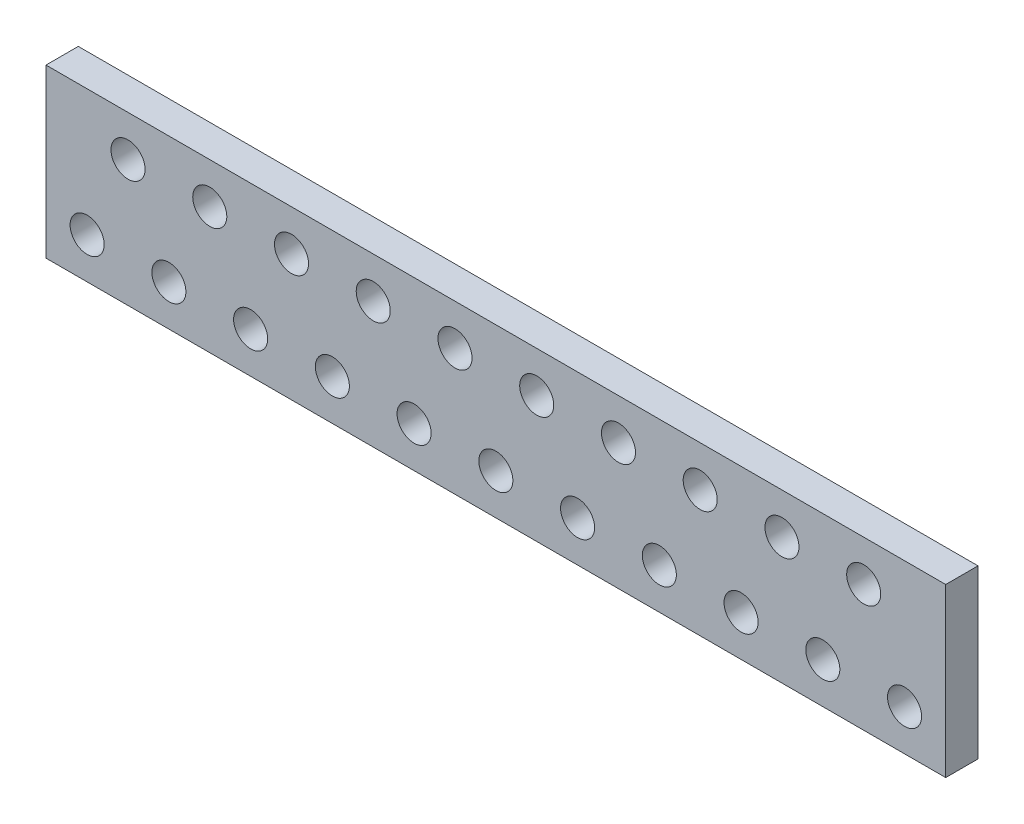
from build123d import *

# Parameters (mm, degrees)
SKETCH1_W          = 39.624
SKETCH1_H          = 7.366
PEEK_DEPTH         = 1.4224
SKETCH2_R          = 0.75
CUT_EXTRUDE1_DEPTH = 21.201560701


with BuildPart() as part:
    # Sketch1 → PEEK (new body)
    with BuildSketch(Plane.XY):
        Rectangle(SKETCH1_W, SKETCH1_H)
    extrude(amount=PEEK_DEPTH)

    # Sketch2 → Cut-Extrude1 (cut, through all)
    with BuildSketch(Plane(origin=(0, 0, 0), x_dir=(-1, 0, 0), z_dir=(0, 0, -1))):
        with Locations((-18, -1.885)):
            Circle(SKETCH2_R)
        with Locations((-14.4, -1.885)):
            Circle(SKETCH2_R)
        with Locations((-10.8, -1.885)):
            Circle(SKETCH2_R)
        with Locations((-7.2, -1.885)):
            Circle(SKETCH2_R)
        with Locations((-3.6, -1.885)):
            Circle(SKETCH2_R)
        with Locations((0, -1.885)):
            Circle(SKETCH2_R)
        with Locations((3.6, -1.885)):
            Circle(SKETCH2_R)
        with Locations((7.2, -1.885)):
            Circle(SKETCH2_R)
        with Locations((10.8, -1.885)):
            Circle(SKETCH2_R)
        with Locations((14.4, -1.885)):
            Circle(SKETCH2_R)
        with Locations((18, -1.885)):
            Circle(SKETCH2_R)
        with Locations((16.2, 1.885)):
            Circle(SKETCH2_R)
        with Locations((12.6, 1.885)):
            Circle(SKETCH2_R)
        with Locations((9, 1.885)):
            Circle(SKETCH2_R)
        with Locations((5.4, 1.885)):
            Circle(SKETCH2_R)
        with Locations((1.8, 1.885)):
            Circle(SKETCH2_R)
        with Locations((-1.8, 1.885)):
            Circle(SKETCH2_R)
        with Locations((-5.4, 1.885)):
            Circle(SKETCH2_R)
        with Locations((-9, 1.885)):
            Circle(SKETCH2_R)
        with Locations((-12.6, 1.885)):
            Circle(SKETCH2_R)
        with Locations((-16.2, 1.885)):
            Circle(SKETCH2_R)
    extrude(amount=-CUT_EXTRUDE1_DEPTH, mode=Mode.SUBTRACT)


solid = part.part
